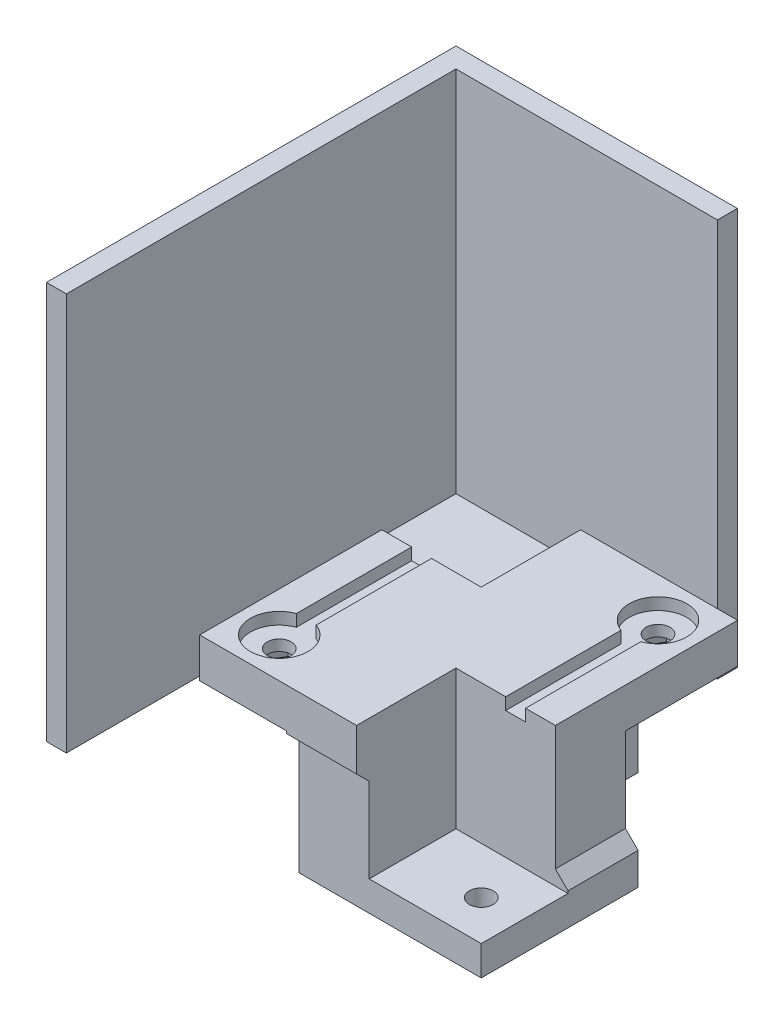
from build123d import *

# Parameters (mm, degrees)
SKETCH1_W           = 28.32
SKETCH1_H           = 25.78
SKETCH1_R           = 1.2
BOSS_EXTRUDE1_DEPTH = 3
SKETCH4_W           = 25.78
SKETCH4_H           = 28.32
SKETCH4_R           = 1.2
BOSS_EXTRUDE2_DEPTH = 4
SKETCH5_W           = 10
SKETCH5_H           = 10
CUT_EXTRUDE2_DEPTH  = 4
SKETCH8_W           = 10
SKETCH8_H           = 10
CUT_EXTRUDE3_DEPTH  = 3
BOSS_EXTRUDE3_DEPTH = 10
SKETCH3_R           = 2.9
CUT_EXTRUDE4_DEPTH  = 1.2
CHAMFER1_SIZE       = 1.5
BOSS_EXTRUDE4_DEPTH = 3
EXTRUDE_THIN1_START = -3
EXTRUDE_THIN1_DEPTH = 40
CUT_EXTRUDE5_DEPTH  = 1.7
CHAMFER2_SIZE       = 0.5
CUT_EXTRUDE6_DEPTH  = 1.2


with BuildPart() as part:
    # Sketch1 → Boss-Extrude1 (new body)
    with BuildSketch(Plane(origin=(0, 0, 0), x_dir=(1, 0, 0), z_dir=(0, 1, 0))):
        Rectangle(SKETCH1_W, SKETCH1_H)
        with Locations(Location((-10.16, 8.89, 0), (0, 0, 270))):
            Circle(SKETCH1_R, mode=Mode.SUBTRACT)
        with Locations(Location((10.16, 8.89, 0), (0, 0, 270))):
            Circle(SKETCH1_R, mode=Mode.SUBTRACT)
        with Locations(Location((10.16, -8.89, 0), (0, 0, 270))):
            Circle(SKETCH1_R, mode=Mode.SUBTRACT)
        with Locations(Location((-10.16, -8.89, 0), (0, 0, 270))):
            Circle(SKETCH1_R, mode=Mode.SUBTRACT)
    extrude(amount=BOSS_EXTRUDE1_DEPTH)

    # Sketch8 → Cut-Extrude3 (cut)
    with BuildSketch(Plane.XZ):
        with Locations((-9.16, 7.89)):
            Rectangle(SKETCH8_W, SKETCH8_H)
        with Locations((9.16, -7.89)):
            Rectangle(SKETCH8_W, SKETCH8_H)
    extrude(amount=-CUT_EXTRUDE3_DEPTH, mode=Mode.SUBTRACT)



with BuildPart() as body_2:
    # Sketch4 → Boss-Extrude2 (new body)
    with BuildSketch(Plane(origin=(0, 13, 0), x_dir=(1, 0, 0), z_dir=(0, 1, 0))):
        Rectangle(SKETCH4_W, SKETCH4_H)
        with Locations(Location((-8.89, 10.16, 0), (0, 0, 270))):
            Circle(SKETCH4_R, mode=Mode.SUBTRACT)
        with Locations(Location((8.89, 10.16, 0), (0, 0, 270))):
            Circle(SKETCH4_R, mode=Mode.SUBTRACT)
        with Locations(Location((-8.89, -10.16, 0), (0, 0, 270))):
            Circle(SKETCH4_R, mode=Mode.SUBTRACT)
        with Locations(Location((8.89, -10.16, 0), (0, 0, 270))):
            Circle(SKETCH4_R, mode=Mode.SUBTRACT)
    extrude(amount=BOSS_EXTRUDE2_DEPTH)

    # Sketch5 → Cut-Extrude2 (cut)
    with BuildSketch(Plane(origin=(0, 17, 0), x_dir=(1, 0, 0), z_dir=(0, 1, 0))):
        with Locations((-7.89, 9.16)):
            Rectangle(SKETCH5_W, SKETCH5_H)
        with Locations((7.89, -9.16)):
            Rectangle(SKETCH5_W, SKETCH5_H)
    extrude(amount=-CUT_EXTRUDE2_DEPTH, mode=Mode.SUBTRACT)


with BuildPart() as part_1:
    add(part.part)

    add(body_2.part)  # Boss-Extrude3 merges body 2
    # Sketch9 → Boss-Extrude3 (add)
    with BuildSketch(Plane.XZ.offset(-13)):
        Polygon((2.89, 4.16), (2.89, 12.89), (-4.16, 12.89), (-4.16, 2.89), (-12.89, 2.89), (-12.89, -4.16), (-2.89, -4.16), (-2.89, -12.89), (4.16, -12.89), (4.16, -2.89), (12.89, -2.89), (12.89, 4.16), align=None)
    extrude(amount=BOSS_EXTRUDE3_DEPTH)

    # Sketch3 → Cut-Extrude4 (cut)
    with BuildSketch(Plane(origin=(0, 17, 0), x_dir=(1, 0, 0), z_dir=(0, 1, 0))):
        with Locations(Location((8.89, 10.16, 0), (0, 0, 270))):
            Circle(SKETCH3_R)
        with Locations(Location((-8.89, -10.16, 0), (0, 0, 270))):
            Circle(SKETCH3_R)
    extrude(amount=-CUT_EXTRUDE4_DEPTH, mode=Mode.SUBTRACT)

    # Chamfer1
    # the kernel refuses this chamfer: 1.5 mm, written as the material it adds along each edge
    with BuildSketch(Plane(origin=(-2.89, 13, -12.89), x_dir=(0, -0.9996219169112968, 0.027495876610585616), z_dir=(1, 0, 0))) as chamfer1_piece_1_section:
        Polygon((CHAMFER1_SIZE * 0.999621916911, CHAMFER1_SIZE * 0.0274958766106), (-CHAMFER1_SIZE * 0.0274958766106, CHAMFER1_SIZE * 0.999621916911), (0, 0), align=None)
    chamfer1_piece_1 = extrude(amount=7.05, mode=Mode.PRIVATE)
    chamfer1_piece_1 = split(chamfer1_piece_1, bisect_by=Plane(origin=(0.635, 12.489006397, -14.16), z_dir=(0, 0, 1)), keep=Keep.TOP, mode=Mode.PRIVATE)
    add(chamfer1_piece_1)
    with BuildSketch(Plane(origin=(2.89, 13, 12.89), x_dir=(0, -0.9996219169112965, -0.02749587661058676), z_dir=(-1, 0, 0))) as chamfer1_piece_2_section:
        Polygon((CHAMFER1_SIZE * 0.999621916911, CHAMFER1_SIZE * 0.0274958766106), (-CHAMFER1_SIZE * 0.0274958766106, CHAMFER1_SIZE * 0.999621916911), (0, 0), align=None)
    chamfer1_piece_2 = extrude(amount=7.05, mode=Mode.PRIVATE)
    chamfer1_piece_2 = split(chamfer1_piece_2, bisect_by=Plane(origin=(-0.635, 12.489006397, 14.16), z_dir=(0, 0, -1)), keep=Keep.TOP, mode=Mode.PRIVATE)
    add(chamfer1_piece_2)
    with BuildSketch(Plane(origin=(12.89, 3, -2.89), x_dir=(0.9996219169112965, -0.027495876610587625, 0), z_dir=(0, 0, 1))) as chamfer1_piece_3_section:
        Polygon((CHAMFER1_SIZE * 0.999621916911, CHAMFER1_SIZE * 0.0274958766106), (-CHAMFER1_SIZE * 0.0274958766106, CHAMFER1_SIZE * 0.999621916911), (0, 0), align=None)
    chamfer1_piece_3 = extrude(amount=7.05, mode=Mode.PRIVATE)
    chamfer1_piece_3 = split(chamfer1_piece_3, bisect_by=Plane(origin=(14.16, 3.510993603, 0.635), z_dir=(-1, 0, 0)), keep=Keep.TOP, mode=Mode.PRIVATE)
    add(chamfer1_piece_3)
    with BuildSketch(Plane(origin=(-12.89, 3, 2.89), x_dir=(-0.9996219169112965, -0.027495876610587625, 0), z_dir=(0, 0, -1))) as chamfer1_piece_4_section:
        Polygon((CHAMFER1_SIZE * 0.999621916911, CHAMFER1_SIZE * 0.0274958766106), (-CHAMFER1_SIZE * 0.0274958766106, CHAMFER1_SIZE * 0.999621916911), (0, 0), align=None)
    chamfer1_piece_4 = extrude(amount=7.05, mode=Mode.PRIVATE)
    chamfer1_piece_4 = split(chamfer1_piece_4, bisect_by=Plane(origin=(-14.16, 3.510993603, -0.635), z_dir=(1, 0, 0)), keep=Keep.TOP, mode=Mode.PRIVATE)
    add(chamfer1_piece_4)

    # Sketch10 → Boss-Extrude4 (add)
    with BuildSketch(Plane(origin=(0, 3, 0), x_dir=(1, 0, 0), z_dir=(0, 1, 0))):
        Polygon((-28.302135624, 12.89), (-14.16, -2.89), (-14.16, 12.89), (4.16, 12.89), (-14.16, 27.032135624), (-28.302135624, 27.032135624), align=None)
    extrude(amount=-BOSS_EXTRUDE4_DEPTH)

    # Sketch11 → Extrude-Thin1 (add)
    with BuildSketch(Plane(origin=(0, 3, 0), x_dir=(1, 0, 0), z_dir=(0, 1, 0)).offset(EXTRUDE_THIN1_START)):
        Polygon((-28.302135624, -14.16), (-28.302135624, 27.032135624), (0, 27.032135624), (0, 25.032135624), (-26.302135624, 25.032135624), (-26.302135624, -14.16), align=None)
    extrude(amount=EXTRUDE_THIN1_DEPTH)

    # Sketch12 → Cut-Extrude5 (cut)
    with BuildSketch(Plane.XZ.offset(-13)):
        Polygon((-10.076454803, 12.215), (-11.262909606, 10.16), (-10.076454803, 8.105), (-7.703545197, 8.105), (-6.517090394, 10.16), (-7.703545197, 12.215), align=None)
        Polygon((10.076454803, -12.215), (11.262909606, -10.16), (10.076454803, -8.105), (7.703545197, -8.105), (6.517090394, -10.16), (7.703545197, -12.215), align=None)
    extrude(amount=-CUT_EXTRUDE5_DEPTH, mode=Mode.SUBTRACT)

    # Chamfer2
    chamfer2_edges = [part_1.edges().sort_by_distance(p)[0] for p in [
        (-8.89, 13, 12.215),
        (-10.669682205, 13, 11.1875),
        (-10.669682205, 13, 9.1325),
        (-8.89, 13, 8.105),
        (-7.110317795, 13, 9.1325),
        (-7.110317795, 13, 11.1875),
        (8.89, 13, -12.215),
        (10.669682205, 13, -11.1875),
        (10.669682205, 13, -9.1325),
        (8.89, 13, -8.105),
        (7.110317795, 13, -9.1325),
        (7.110317795, 13, -11.1875),
    ]]
    chamfer(chamfer2_edges, length=CHAMFER2_SIZE)

    # Sketch13 → Cut-Extrude6 (cut)
    with BuildSketch(Plane(origin=(0, 17, 0), x_dir=(1, 0, 0), z_dir=(0, 1, 0))):
        with BuildLine():
            Line((-9.89, 4.16), (-9.89, -7.437868482))
            ThreePointArc((-9.89, -7.437868482), (-8.89, -7.26), (-7.89, -7.437868482))
            Line((-7.89, -7.437868482), (-7.89, 4.16))
            Line((-7.89, 4.16), (-9.89, 4.16))
        make_face()
        with BuildLine():
            ThreePointArc((9.89, 7.437868482), (8.89, 7.26), (7.89, 7.437868482))
            Line((7.89, 7.437868482), (7.89, -4.16))
            Line((7.89, -4.16), (9.89, -4.16))
            Line((9.89, -4.16), (9.89, 7.437868482))
        make_face()
    extrude(amount=-CUT_EXTRUDE6_DEPTH, mode=Mode.SUBTRACT)


solid = part_1.part
